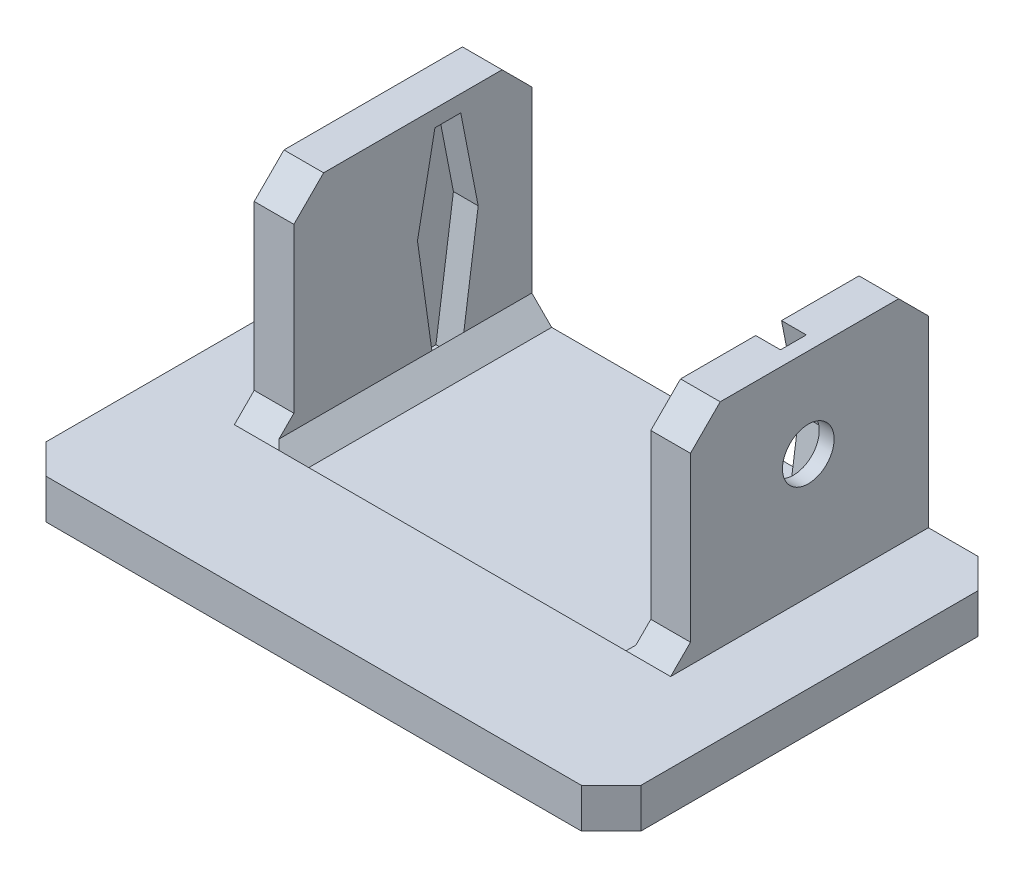
from build123d import *

# Parameters (mm, degrees)
SKETCH1_W           = 60
SKETCH1_H           = 40
BOSS_EXTRUDE1_DEPTH = 4
CHAMFER1_SIZE       = 3
SKETCH2_W           = 36
SKETCH2_H           = 24
CUT_EXTRUDE1_DEPTH  = 1.5
SKETCH3_W           = 4
SKETCH3_H           = 24
BOSS_EXTRUDE2_DEPTH = 23
CHAMFER2_SIZE       = 3
CHAMFER3_SIZE       = 2
CHAMFER4_SIZE       = 2
CHAMFER5_SIZE       = 2
CUT_EXTRUDE2_DEPTH  = 2.5
SKETCH7_R           = 2.604037506
CUT_EXTRUDE3_DEPTH  = 70.285640648
CUT_EXTRUDE4_DEPTH  = 2.5


with BuildPart() as part:
    # Sketch1 → Boss-Extrude1 (new body)
    with BuildSketch(Plane(origin=(0, 0, 0), x_dir=(1, 0, 0), z_dir=(0, 1, 0))):
        with Locations((30, -20)):
            Rectangle(SKETCH1_W, SKETCH1_H)
    extrude(amount=BOSS_EXTRUDE1_DEPTH)

    # Chamfer1
    chamfer1_edges = [part.edges().sort_by_distance(p)[0] for p in [
        (0, 2, 0),
        (60, 2, 0),
        (60, 2, 40),
        (0, 2, 40),
    ]]
    chamfer(chamfer1_edges, length=CHAMFER1_SIZE)

    # Sketch2 → Cut-Extrude1 (cut)
    with BuildSketch(Plane(origin=(0, 4, 0), x_dir=(1, 0, 0), z_dir=(0, 1, 0))):
        with Locations((30, -12)):
            Rectangle(SKETCH2_W, SKETCH2_H)
    extrude(amount=-CUT_EXTRUDE1_DEPTH, mode=Mode.SUBTRACT)

    # Sketch3 → Boss-Extrude2 (add)
    with BuildSketch(Plane(origin=(0, 2.5, 0), x_dir=(1, 0, 0), z_dir=(0, 1, 0))):
        with Locations((50, -12)):
            Rectangle(SKETCH3_W, SKETCH3_H)
        with Locations((10, -12)):
            Rectangle(SKETCH3_W, SKETCH3_H)
    extrude(amount=BOSS_EXTRUDE2_DEPTH)

    # Chamfer2
    chamfer2_edges = [part.edges().sort_by_distance(p)[0] for p in [
        (50, 25.5, 24),
        (50, 25.5, 0),
        (10, 25.5, 0),
        (10, 25.5, 24),
    ]]
    chamfer(chamfer2_edges, length=CHAMFER2_SIZE)

    # Chamfer3
    chamfer3_edges = [part.edges().sort_by_distance(p)[0] for p in [
        (50, 4, 24),
        (10, 4, 24),
    ]]
    chamfer(chamfer3_edges, length=CHAMFER3_SIZE)

    # Chamfer4
    # the kernel refuses this chamfer: 2 mm, written as the material it takes off along each edge
    with BuildSketch(Plane(origin=(48, 4, 24), x_dir=(0, -0.9996219169112968, -0.027495876610585623), z_dir=(-1, 0, 0))) as chamfer4_piece_1_section:
        Polygon((CHAMFER4_SIZE * 0.999621916911, CHAMFER4_SIZE * 0.0274958766106), (-CHAMFER4_SIZE * 0.0274958766106, CHAMFER4_SIZE * 0.999621916911), (0, 0), align=None)
    chamfer4_piece_1 = extrude(amount=36, mode=Mode.PRIVATE)
    chamfer4_piece_1 = split(chamfer4_piece_1, bisect_by=Plane(origin=(30, 2.5, 24.699033576), z_dir=(0, 1, 0)), keep=Keep.TOP, mode=Mode.PRIVATE)
    chamfer4_piece_1 = split(chamfer4_piece_1, bisect_by=Plane(origin=(30, 4.361799404, 25.638200596), z_dir=(0, -0.7071067811865476, -0.7071067811865476)), keep=Keep.TOP, mode=Mode.PRIVATE)
    add(chamfer4_piece_1, mode=Mode.SUBTRACT)

    # Chamfer5
    # the kernel refuses this chamfer: 2 mm, written as the material it adds along each edge
    with BuildSketch(Plane(origin=(12, 2.5, 29.643365976), x_dir=(-0.027495876610586487, 0.9996219169112968, 0), z_dir=(0, 0, -1))) as chamfer5_piece_1_section:
        Polygon((CHAMFER5_SIZE * 0.999621916911, CHAMFER5_SIZE * 0.0274958766106), (-CHAMFER5_SIZE * 0.0274958766106, CHAMFER5_SIZE * 0.999621916911), (0, 0), align=None)
    chamfer5_piece_1 = extrude(amount=29.643365976, mode=Mode.PRIVATE)
    chamfer5_piece_1 = split(chamfer5_piece_1, bisect_by=Plane(origin=(12.696713147, 10.276643426, 19.723356574), z_dir=(0, -0.7071067811865476, -0.7071067811865476)), keep=Keep.TOP, mode=Mode.PRIVATE)
    add(chamfer5_piece_1)
    with BuildSketch(Plane(origin=(48, 2.5, 29.643365976), x_dir=(-0.9996219169112968, -0.027495876610586296, 0), z_dir=(0, 0, -1))) as chamfer5_piece_2_section:
        Polygon((CHAMFER5_SIZE * 0.999621916911, CHAMFER5_SIZE * 0.0274958766106), (-CHAMFER5_SIZE * 0.0274958766106, CHAMFER5_SIZE * 0.999621916911), (0, 0), align=None)
    chamfer5_piece_2 = extrude(amount=29.643365976, mode=Mode.PRIVATE)
    chamfer5_piece_2 = split(chamfer5_piece_2, bisect_by=Plane(origin=(47.833064516, 10.624596774, 19.375403226), z_dir=(0, -0.7071067811865476, -0.7071067811865476)), keep=Keep.TOP, mode=Mode.PRIVATE)
    add(chamfer5_piece_2)

    # Sketch4 → Cut-Extrude2 (cut)
    with BuildSketch(Plane.ZY.offset(-48)):
        Polygon((9.05620064, 16.5), (10.815025537, 25.5), (13.420692052, 25.5), (15.179516949, 16.5), (13.420692052, 4), (10.815025537, 4), align=None)
    extrude(amount=-CUT_EXTRUDE2_DEPTH, mode=Mode.SUBTRACT)

    # Sketch7 → Cut-Extrude3 (cut, through all)
    with BuildSketch(Plane.ZY.offset(-50.5)):
        with Locations((12.117858795, 16.5)):
            Circle(SKETCH7_R)
    extrude(amount=-CUT_EXTRUDE3_DEPTH, mode=Mode.SUBTRACT)

    # Sketch8 → Cut-Extrude4 (cut)
    with BuildSketch(Plane(origin=(12, 0, 0), x_dir=(0, 0, -1), z_dir=(1, 0, 0))):
        Polygon((-11.53257408, 14.821897089), (-9.773749183, 23.821897089), (-7.168082669, 23.821897089), (-5.409257772, 14.821897089), (-7.168082669, 2.321897089), (-9.773749183, 2.321897089), align=None)
    extrude(amount=-CUT_EXTRUDE4_DEPTH, mode=Mode.SUBTRACT)


solid = part.part
